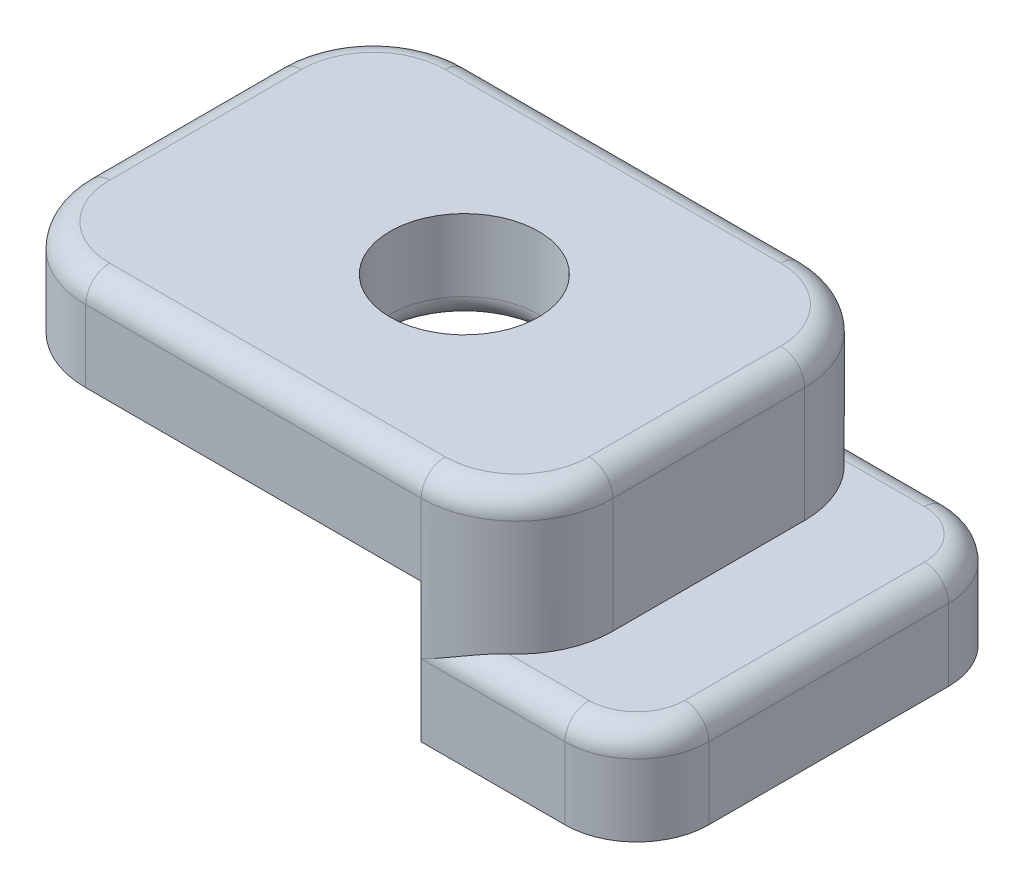
from build123d import *

# Parameters (mm, degrees)
BOSS_EXTRUDE1_DEPTH     = 2
CUT_EXTRUDE1_DEPTH      = 8.088723439
CUT_EXTRUDE1_DEPTH_BACK = 8.088723439
SKETCH2_R               = 1.55
BOSS_EXTRUDE2_START     = 2.9
BOSS_EXTRUDE2_DEPTH     = 2.9
BOSS_EXTRUDE3_DEPTH     = 2
FILLET1_R               = 0.5


with BuildPart() as part:
    # Sketch1 → Boss-Extrude1 (new body)
    with BuildSketch(Plane(origin=(0, 0, 0), x_dir=(1, 0, 0), z_dir=(0, 1, 0))):
        with BuildLine():
            Line((3.5, 4), (-3.5, 4))
            ThreePointArc((-3.5, 4), (-4.914213562, 3.414213562), (-5.5, 2))
            Line((-5.5, 2), (-5.5, -2))
            ThreePointArc((-5.5, -2), (-4.914213562, -3.414213562), (-3.5, -4))
            Line((-3.5, -4), (3.5, -4))
            ThreePointArc((3.5, -4), (4.914213562, -3.414213562), (5.5, -2))
            Line((5.5, -2), (5.5, 2))
            ThreePointArc((5.5, 2), (4.914213562, 3.414213562), (3.5, 4))
        make_face()
    extrude(amount=BOSS_EXTRUDE1_DEPTH)

    # Sketch2 → Cut-Extrude1 (cut, two sides: drawn at the far end of the back side and taken through both)
    with BuildSketch(Plane(origin=(0, 2, 0), x_dir=(1, 0, 0), z_dir=(0, 1, 0)).offset(-CUT_EXTRUDE1_DEPTH_BACK)):
        with Locations(Location((0.4, 0, 0), (0, 0, 270))):
            Circle(SKETCH2_R)
    extrude(amount=CUT_EXTRUDE1_DEPTH + CUT_EXTRUDE1_DEPTH_BACK, mode=Mode.SUBTRACT)

    # Sketch3 → Boss-Extrude2 (add)
    with BuildSketch(Plane.XZ.offset(BOSS_EXTRUDE2_START)):
        with BuildLine():
            Line((5.5, 2), (5.5, -2))
            ThreePointArc((5.5, -2), (4.914213562, -3.414213562), (3.5, -4))
            Line((3.5, -4), (3.5, 4))
            ThreePointArc((3.5, 4), (4.914213562, 3.414213562), (5.5, 2))
        make_face()
    extrude(amount=-BOSS_EXTRUDE2_DEPTH)

    # Sketch4 → Boss-Extrude3 (add)
    with BuildSketch(Plane.XZ.offset(2.9)):
        with BuildLine():
            Line((5.5, 2), (5.5, -2))
            ThreePointArc((5.5, -2), (4.914213562, -3.414213562), (3.5, -4))
            Line((3.5, -4), (6.5, -4))
            ThreePointArc((6.5, -4), (7.560660172, -3.560660172), (8, -2.5))
            Line((8, -2.5), (8, 2.5))
            ThreePointArc((8, 2.5), (7.560660172, 3.560660172), (6.5, 4))
            Line((6.5, 4), (3.5, 4))
            ThreePointArc((3.5, 4), (4.914213562, 3.414213562), (5.5, 2))
        make_face()
    extrude(amount=-BOSS_EXTRUDE3_DEPTH)

    # Fillet1
    # the kernel refuses this fillet: 0.5 mm, written as the material it takes off along each edge
    with BuildSketch(Plane(origin=(-3.5, 2, 2), x_dir=(-1, 0, 0), z_dir=(0, 0, -1))) as fillet1_piece_1:
        with BuildLine():
            CenterArc((2 - FILLET1_R, -FILLET1_R), FILLET1_R, 0, 90)
            Line((2, -FILLET1_R), (2, 0))
            Line((2, 0), (2 - FILLET1_R, 0))
        make_face()
    revolve(axis=Axis((-3.5, 2, 2), (0, 1, 0)), revolution_arc=90, mode=Mode.SUBTRACT)
    with BuildSketch(Plane(origin=(-3.5, 2, 4), x_dir=(0, 0, -1), z_dir=(1, 0, 0)), Plane(origin=(3.5, 2, -4), x_dir=(0, 0, 1), z_dir=(-1, 0, 0))) as fillet1_piece_2:
        with BuildLine():
            CenterArc((FILLET1_R, -FILLET1_R), FILLET1_R, 90, 90)
            Line((0, -FILLET1_R), (0, 0))
            Line((0, 0), (FILLET1_R, 0))
        make_face()
    extrude(amount=7, mode=Mode.SUBTRACT)
    with BuildSketch(Plane(origin=(3.5, 2, 2), x_dir=(0, 0, 1), z_dir=(-1, 0, 0))) as fillet1_piece_3:
        with BuildLine():
            CenterArc((2 - FILLET1_R, -FILLET1_R), FILLET1_R, 0, 90)
            Line((2 - FILLET1_R, 0), (2, 0))
            Line((2, 0), (2, -FILLET1_R))
        make_face()
    revolve(axis=Axis((3.5, 2, 2), (0, 1, 0)), revolution_arc=90, mode=Mode.SUBTRACT)
    with BuildSketch(Plane(origin=(5.5, 2, 2), x_dir=(0, -1, 0), z_dir=(0, 0, -1))) as fillet1_piece_4:
        with BuildLine():
            CenterArc((FILLET1_R, FILLET1_R), FILLET1_R, 180, 90)
            Line((0, FILLET1_R), (0, 0))
            Line((0, 0), (FILLET1_R, 0))
        make_face()
    extrude(amount=4, mode=Mode.SUBTRACT)
    with BuildSketch(Plane(origin=(0.4, 0, 0), x_dir=(0, 0, 1), z_dir=(-1, 0, 0))) as fillet1_piece_5:
        with BuildLine():
            CenterArc((1.55 + FILLET1_R, FILLET1_R), FILLET1_R, 180, 90)
            Line((1.55 + FILLET1_R, 0), (1.55, 0))
            Line((1.55, 0), (1.55, FILLET1_R))
        make_face()
    revolve(axis=Axis((0.4, 0, 0), (0, 1, 0)), mode=Mode.SUBTRACT)
    with BuildSketch(Plane(origin=(3.5, 2, -2), x_dir=(1, 0, 0), z_dir=(0, 0, 1))) as fillet1_piece_6:
        with BuildLine():
            CenterArc((2 - FILLET1_R, -FILLET1_R), FILLET1_R, 0, 90)
            Line((2 - FILLET1_R, 0), (2, 0))
            Line((2, 0), (2, -FILLET1_R))
        make_face()
    revolve(axis=Axis((3.5, 2, -2), (0, 1, 0)), revolution_arc=90, mode=Mode.SUBTRACT)
    with BuildSketch(Plane(origin=(6.5, -0.9, 4), x_dir=(0, 0, -1), z_dir=(-1, 0, 0))) as fillet1_piece_7_section:
        with BuildLine():
            CenterArc((FILLET1_R, FILLET1_R), FILLET1_R, 180, 90)
            Line((0, FILLET1_R), (0, 0))
            Line((0, 0), (FILLET1_R, 0))
        make_face()
    fillet1_piece_7 = extrude(amount=4.25, mode=Mode.PRIVATE)
    fillet1_piece_7 = fillet1_piece_7 - Plane(origin=(3.5, -0.984531393, 2), x_dir=(0, 0, 1), z_dir=(0, -1, 0)) * Cylinder(2, 11, mode=Mode.PRIVATE)
    add(fillet1_piece_7, mode=Mode.SUBTRACT)
    with BuildSketch(Plane(origin=(6.5, -0.9, 2.5), x_dir=(1, 0, 0), z_dir=(0, 0, -1))) as fillet1_piece_8:
        with BuildLine():
            CenterArc((1.5 - FILLET1_R, FILLET1_R), FILLET1_R, 270, 90)
            Line((1.5, FILLET1_R), (1.5, 0))
            Line((1.5, 0), (1.5 - FILLET1_R, 0))
        make_face()
    revolve(axis=Axis((6.5, -0.9, 2.5), (0, -1, 0)), revolution_arc=90, mode=Mode.SUBTRACT)
    with BuildSketch(Plane(origin=(8, -0.9, -2.5), x_dir=(-1, 0, 0), z_dir=(0, 0, 1))) as fillet1_piece_9:
        with BuildLine():
            CenterArc((FILLET1_R, FILLET1_R), FILLET1_R, 180, 90)
            Line((0, FILLET1_R), (0, 0))
            Line((0, 0), (FILLET1_R, 0))
        make_face()
    extrude(amount=5, mode=Mode.SUBTRACT)
    with BuildSketch(Plane(origin=(6.5, -0.9, -2.5), x_dir=(0, 0, -1), z_dir=(-1, 0, 0))) as fillet1_piece_10:
        with BuildLine():
            CenterArc((1.5 - FILLET1_R, FILLET1_R), FILLET1_R, 270, 90)
            Line((1.5, FILLET1_R), (1.5, 0))
            Line((1.5, 0), (1.5 - FILLET1_R, 0))
        make_face()
    revolve(axis=Axis((6.5, -0.9, -2.5), (0, -1, 0)), revolution_arc=90, mode=Mode.SUBTRACT)
    with BuildSketch(Plane(origin=(2.25, -0.9, -4), x_dir=(0, 0, 1), z_dir=(1, 0, 0))) as fillet1_piece_11_section:
        with BuildLine():
            CenterArc((FILLET1_R, FILLET1_R), FILLET1_R, 180, 90)
            Line((0, FILLET1_R), (0, 0))
            Line((0, 0), (FILLET1_R, 0))
        make_face()
    fillet1_piece_11 = extrude(amount=4.25, mode=Mode.PRIVATE)
    fillet1_piece_11 = fillet1_piece_11 - Plane(origin=(3.5, -1.027464109, -2), x_dir=(1, 0, 0), z_dir=(0, -1, 0)) * Cylinder(2, 11, mode=Mode.PRIVATE)
    add(fillet1_piece_11, mode=Mode.SUBTRACT)
    with BuildSketch(Plane(origin=(-3.5, 2, -2), x_dir=(0, 0, -1), z_dir=(1, 0, 0))) as fillet1_piece_12:
        with BuildLine():
            CenterArc((2 - FILLET1_R, -FILLET1_R), FILLET1_R, 0, 90)
            Line((2, -FILLET1_R), (2, 0))
            Line((2, 0), (2 - FILLET1_R, 0))
        make_face()
    revolve(axis=Axis((-3.5, 2, -2), (0, 1, 0)), revolution_arc=90, mode=Mode.SUBTRACT)
    with BuildSketch(Plane(origin=(-5.5, 2, -2), x_dir=(1, 0, 0), z_dir=(0, 0, 1))) as fillet1_piece_13:
        with BuildLine():
            CenterArc((FILLET1_R, -FILLET1_R), FILLET1_R, 90, 90)
            Line((0, -FILLET1_R), (0, 0))
            Line((0, 0), (FILLET1_R, 0))
        make_face()
    extrude(amount=4, mode=Mode.SUBTRACT)


solid = part.part
